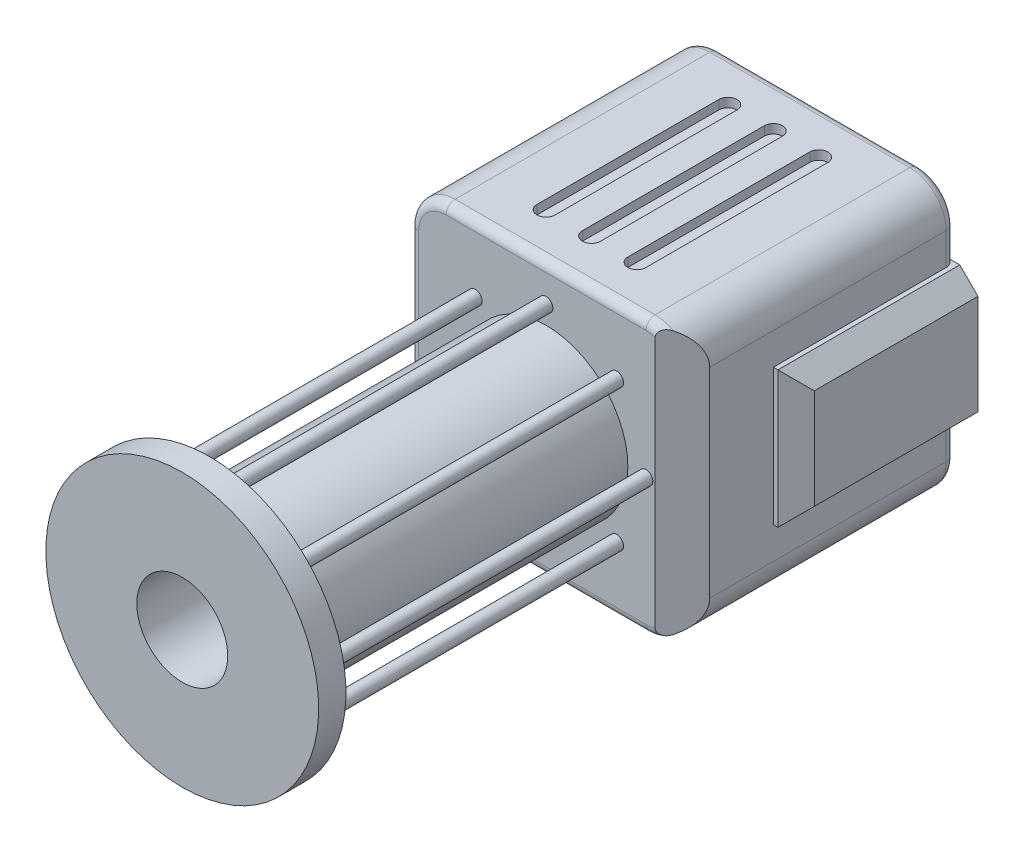
from build123d import *

# Parameters (mm, degrees)
SKETCH1_W               = 30
SKETCH1_H               = 30
BOSS_EXTRUDE1_DEPTH     = 15
FILLET1_R               = 4
CHAMFER2_SIZE           = 3
FILLET2_R               = 1
SKETCH3_R               = 10
BOSS_EXTRUDE2_DEPTH     = 2.5
FILLET3_R               = 5
SKETCH5_W               = 5
SKETCH5_H               = 15
BOSS_EXTRUDE3_DEPTH     = 20
CHAMFER3_SIZE           = 2
CUT_EXTRUDE1_DEPTH      = 77.075620293
CUT_EXTRUDE1_DEPTH_BACK = 10
SKETCH6_R               = 5
SKETCH7_R               = 0.75
BOSS_EXTRUDE4_DEPTH     = 40
CIRPATTERN1_COUNT       = 8
SKETCH8_R               = 5
CUT_EXTRUDE2_DEPTH      = 10
CUT_EXTRUDE3_DEPTH      = 1
LPATTERN1_COUNT         = 2
LPATTERN1_PITCH         = 5
LPATTERN1_COL_COUNT     = 2
LPATTERN1_COL_PITCH     = 5


with BuildPart() as part:
    # Sketch1 → Boss-Extrude1 (new, symmetric)
    with BuildSketch(Plane.XY):
        Rectangle(SKETCH1_W, SKETCH1_H)
    extrude(amount=BOSS_EXTRUDE1_DEPTH, both=True)

    # Sketch2 → Revolve1 (revolve)
    with BuildSketch(Plane(origin=(0, 0, 0), x_dir=(0, 0, -1), z_dir=(1, 0, 0))):
        Polygon((-55, 0), (-55, 15), (-52, 15), (-52, 9), (-15, 9), (-15, 0), align=None)
    revolve(axis=Axis((0, 0, 15), (0, 0, 1)))

    # Fillet1
    fillet1_edges = [part.edges().sort_by_distance(p)[0] for p in [
        (15, -15, 0),
        (-15, -15, 0),
        (-15, 15, 0),
        (15, 15, 0),
    ]]
    fillet(fillet1_edges, radius=FILLET1_R)

    # Chamfer2
    # the kernel refuses this chamfer: 3 mm, written as the material it takes off along each edge
    with BuildSketch(Plane(origin=(15, 18.715048964, 15), x_dir=(-0.9996219169112969, 0, 0.02749587661058621), z_dir=(0, -1, 0))) as chamfer2_piece_1:
        Polygon((CHAMFER2_SIZE * 0.999621916911, CHAMFER2_SIZE * 0.0274958766106), (-CHAMFER2_SIZE * 0.0274958766106, CHAMFER2_SIZE * 0.999621916911), (0, 0), align=None)
    extrude(amount=37.430097928, mode=Mode.SUBTRACT)

    # Fillet2
    fillet2_edges = [part.edges().sort_by_distance(p)[0] for p in [
        (13.828427125, 13.828427125, -15),
        (15, 0, -15),
        (13.828427125, -13.828427125, -15),
        (0, -15, -15),
        (-13.828427125, -13.828427125, -15),
        (-15, 0, -15),
        (-13.828427125, 13.828427125, -15),
        (11.50401717, 14.968118785, 15),
        (11.50401717, -14.968118785, 15),
        (0, -15, 15),
        (-13.828427125, -13.828427125, 15),
        (-15, 0, 15),
        (-13.828427125, 13.828427125, 15),
        (0, 15, -15),
        (0, 15, 15),
    ]]
    fillet(fillet2_edges, radius=FILLET2_R)

    # Sketch3 → Boss-Extrude2 (add, symmetric)
    with BuildSketch(Plane(origin=(0, 0, -15), x_dir=(-1, 0, 0), z_dir=(0, 0, -1))):
        with Locations(Location((0, 0, 0), (0, 0, 180))):
            Circle(SKETCH3_R)
    extrude(amount=BOSS_EXTRUDE2_DEPTH, both=True)

    # Fillet3
    # the kernel refuses this fillet: 5 mm, written as the material it takes off along each edge
    with BuildSketch(Plane(origin=(0, 0, -17.5), x_dir=(1, 0, 0), z_dir=(0, 1, 0))) as fillet3_piece_1:
        with BuildLine():
            CenterArc((5.669872981, -5), FILLET3_R, 30, 60)
            Line((5.669872981, 0), (5.669872981, 0.1))
            Line((5.669872981, 0.1), (10, 0.1))
            Line((10, 0.1), (10.1, 0))
            ThreePointArc((10.1, 0), (10.1, -1.25), (10.08660254, -2.45))
            Line((10.08660254, -2.45), (10, -2.5))
        make_face()
    revolve(axis=Axis((0, 0, -17.5), (0, 0, -1)), mode=Mode.SUBTRACT)

    # Sketch5 → Boss-Extrude3 (add)
    with BuildSketch(Plane(origin=(0, 0, -15), x_dir=(-1, 0, 0), z_dir=(0, 0, -1))):
        with Locations((-15, 0)):
            Rectangle(SKETCH5_W, SKETCH5_H)
    extrude(amount=-BOSS_EXTRUDE3_DEPTH)

    # Chamfer3
    chamfer3_edges = [part.edges().sort_by_distance(p)[0] for p in [
        (17.5, 7.5, -5),
        (17.5, 0, 5),
        (17.5, -7.5, -5),
    ]]
    chamfer(chamfer3_edges, length=CHAMFER3_SIZE)

    # Sketch6 → Cut-Extrude1 (cut, two sides: drawn at the far end of the back side and taken through both)
    with BuildSketch(Plane.XY.offset(55).offset(-CUT_EXTRUDE1_DEPTH_BACK)):
        with Locations(Location((0, 0, 0), (0, 0, 180))):
            Circle(SKETCH6_R)
    extrude(amount=CUT_EXTRUDE1_DEPTH + CUT_EXTRUDE1_DEPTH_BACK, mode=Mode.SUBTRACT)

    # Sketch7 → Boss-Extrude4 (add)
    with BuildSketch(Plane.XY.offset(55)):
        with Locations((0, 11)):
            Circle(SKETCH7_R)
    boss_extrude4 = extrude(amount=-BOSS_EXTRUDE4_DEPTH)

    # CirPattern1: Boss-Extrude4 ×8 about axis
    cirpattern1_axis = Axis((0, 0, 0), (0, 0, 1))
    for i in range(1, CIRPATTERN1_COUNT):
        add(boss_extrude4.rotate(cirpattern1_axis, i * 360 / CIRPATTERN1_COUNT))

    # Sketch8 → Cut-Extrude2 (cut)
    with BuildSketch(Plane.ZY.offset(15)):
        with Locations(Location((0, 0, 0), (0, 0, 270))):
            Circle(SKETCH8_R)
    extrude(amount=-CUT_EXTRUDE2_DEPTH, mode=Mode.SUBTRACT)

    # Sketch9 → Cut-Extrude3 (cut)
    with BuildSketch(Plane(origin=(0, 15, 0), x_dir=(1, 0, 0), z_dir=(0, 1, 0))):
        with BuildLine():
            Line((1, 10), (1, -10))
            ThreePointArc((1, -10), (0, -11), (-1, -10))
            Line((-1, -10), (-1, 10))
            ThreePointArc((-1, 10), (0, 11), (1, 10))
        make_face()
    cut_extrude3 = extrude(amount=-CUT_EXTRUDE3_DEPTH, mode=Mode.SUBTRACT)

    # LPattern1: Cut-Extrude3 ×2
    with Locations(*[(i * LPATTERN1_PITCH, 0, 0) for i in range(1, LPATTERN1_COUNT)]):
        add(cut_extrude3, mode=Mode.SUBTRACT)

    # LPattern1 col: Cut-Extrude3 ×2
    with Locations(*[(-i * LPATTERN1_COL_PITCH, 0, 0) for i in range(1, LPATTERN1_COL_COUNT)]):
        add(cut_extrude3, mode=Mode.SUBTRACT)


solid = part.part
